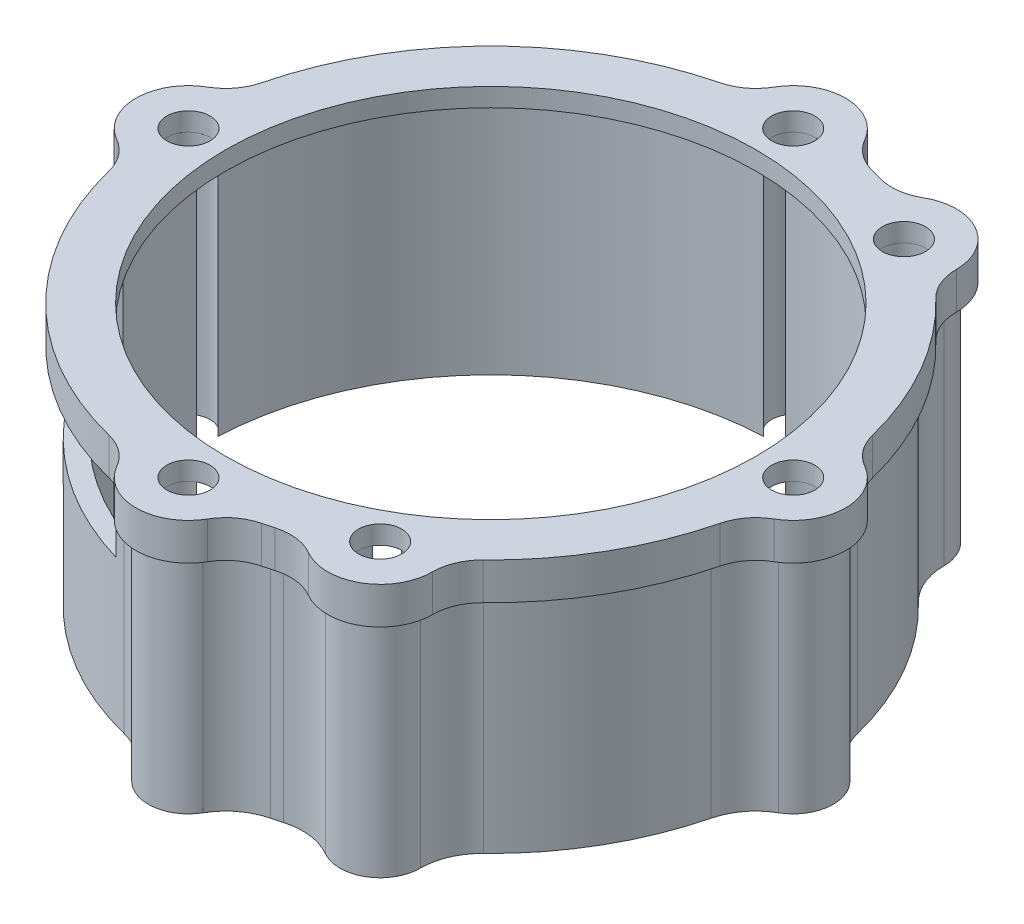
from build123d import *

# Parameters (mm, degrees)
SKETCH1_R               = 49
SKETCH1_R_2             = 46
BOSS_EXTRUDE1_DEPTH     = 39.6
SKETCH4_R               = 49
SKETCH4_R_2             = 43
BOSS_EXTRUDE3_DEPTH     = 3
CUT_EXTRUDE5_DEPTH      = 80.813282103
CUT_EXTRUDE5_DEPTH_BACK = 80.813282103
SKETCH2_R               = 3.5
BOSS_EXTRUDE5_START     = -42.6
BOSS_EXTRUDE5_DEPTH     = 42.6
FILLET1_R               = 10
BOSS_EXTRUDE7_START     = -6
BOSS_EXTRUDE7_DEPTH     = 6
CUT_EXTRUDE8_START      = -16
CUT_EXTRUDE8_DEPTH      = 16
FILLET2_R               = 1


with BuildPart() as part:
    # Sketch1 → Boss-Extrude1 (new body)
    with BuildSketch(Plane(origin=(0, 0, 0), x_dir=(1, 0, 0), z_dir=(0, 1, 0))):
        with Locations(Location((0, 0, 0), (0, 0, 90))):
            Circle(SKETCH1_R)
        with Locations(Location((0, 0, 0), (0, 0, 90))):
            Circle(SKETCH1_R_2, mode=Mode.SUBTRACT)
    extrude(amount=BOSS_EXTRUDE1_DEPTH)

    # Sketch4 → Boss-Extrude3 (add)
    with BuildSketch(Plane(origin=(0, 39.6, 0), x_dir=(1, 0, 0), z_dir=(0, 1, 0))):
        with Locations(Location((0, 0, 0), (0, 0, 90))):
            Circle(SKETCH4_R)
        with Locations(Location((0, 0, 0), (0, 0, 270))):
            Circle(SKETCH4_R_2, mode=Mode.SUBTRACT)
    extrude(amount=BOSS_EXTRUDE3_DEPTH)

    # Sketch2 → Cut-Extrude5 (cut, two sides: drawn at the far end of the back side and taken through both)
    with BuildSketch(Plane(origin=(0, 39.6, 0), x_dir=(1, 0, 0), z_dir=(0, 1, 0)).offset(-CUT_EXTRUDE5_DEPTH_BACK)):
        with Locations((24.5, 42.435244785)):
            Circle(SKETCH2_R)
        with Locations((0, 49)):
            Circle(SKETCH2_R)
        with Locations((24.5, -42.435244785)):
            Circle(SKETCH2_R)
        with Locations((0, -49)):
            Circle(SKETCH2_R)
        with Locations((49, 0)):
            Circle(SKETCH2_R)
        with Locations((-49, 0)):
            Circle(SKETCH2_R)
    extrude(amount=CUT_EXTRUDE5_DEPTH + CUT_EXTRUDE5_DEPTH_BACK, mode=Mode.SUBTRACT)

    # Boss-Extrude5: read off the stored shape, not the designer's step
    # Boss-Extrude5 outline → Boss-Extrude5 (add)
    with BuildSketch(Plane(origin=(0, 42.6, 0), x_dir=(1, 0, 0), z_dir=(0, 1, 0)).offset(BOSS_EXTRUDE5_START)):
        with BuildLine():
            ThreePointArc((21.408344796, 44.075875182), (26.25, 45.466333698), (27.466655204, 40.578108038))
            ThreePointArc((27.466655204, 40.578108038), (28.697413171, 39.717231491), (29.901208316, 38.819038386))
            ThreePointArc((29.901208316, 38.819038386), (27.75, 48.06440991), (18.667669235, 45.304725199))
            ThreePointArc((18.667669235, 45.304725199), (20.047424853, 44.711304574), (21.408344796, 44.075875182))
        make_face()
        with BuildLine():
            ThreePointArc((3.497767145, 48.875), (4.994073084, 48.744838024), (6.485686813, 48.568877551))
            ThreePointArc((6.485686813, 48.568877551), (0, 55.5), (-6.485686813, 48.568877551))
            ThreePointArc((-6.485686813, 48.568877551), (-4.994073084, 48.744838024), (-3.497767145, 48.875))
            ThreePointArc((-3.497767145, 48.875), (0, 52.5), (3.497767145, 48.875))
        make_face()
        with BuildLine():
            ThreePointArc((48.568877551, -6.485686813), (55.5, 0), (48.568877551, 6.485686813))
            ThreePointArc((48.568877551, 6.485686813), (48.744838024, 4.994073084), (48.875, 3.497767145))
            ThreePointArc((48.875, 3.497767145), (52.5, 0), (48.875, -3.497767145))
            ThreePointArc((48.875, -3.497767145), (48.744838024, -4.994073084), (48.568877551, -6.485686813))
        make_face()
        with BuildLine():
            ThreePointArc((-48.875, 3.497767145), (-48.744838024, 4.994073084), (-48.568877551, 6.485686813))
            ThreePointArc((-48.568877551, 6.485686813), (-55.5, 0), (-48.568877551, -6.485686813))
            ThreePointArc((-48.568877551, -6.485686813), (-48.744838024, -4.994073084), (-48.875, -3.497767145))
            ThreePointArc((-48.875, -3.497767145), (-52.5, 0), (-48.875, 3.497767145))
        make_face()
        with BuildLine():
            ThreePointArc((18.667669235, -45.304725199), (27.75, -48.06440991), (29.901208316, -38.819038386))
            ThreePointArc((29.901208316, -38.819038386), (28.697413171, -39.717231491), (27.466655204, -40.578108038))
            ThreePointArc((27.466655204, -40.578108038), (26.25, -45.466333698), (21.408344796, -44.075875182))
            ThreePointArc((21.408344796, -44.075875182), (20.047424853, -44.711304574), (18.667669235, -45.304725199))
        make_face()
        with BuildLine():
            ThreePointArc((-3.497767145, -48.875), (-4.994073084, -48.744838024), (-6.485686813, -48.568877551))
            ThreePointArc((-6.485686813, -48.568877551), (0, -55.5), (6.485686813, -48.568877551))
            ThreePointArc((6.485686813, -48.568877551), (4.994073084, -48.744838024), (3.497767145, -48.875))
            ThreePointArc((3.497767145, -48.875), (0, -52.5), (-3.497767145, -48.875))
        make_face()
    extrude(amount=BOSS_EXTRUDE5_DEPTH)

    # Fillet1
    fillet1_edges = [part.edges().sort_by_distance(p)[0] for p in [
        (48.568877551, 21.3, -6.485686813),
        (48.568877551, 21.3, 6.485686813),
        (-6.485686813, 21.3, -48.568877551),
        (6.485686813, 21.3, -48.568877551),
        (-48.568877551, 21.3, 6.485686813),
        (-48.568877551, 21.3, -6.485686813),
        (6.485686813, 21.3, 48.568877551),
        (-6.485686813, 21.3, 48.568877551),
        (18.667669235, 21.3, -45.304725199),
        (29.901208316, 21.3, -38.819038386),
        (29.901208316, 21.3, 38.819038386),
        (18.667669235, 21.3, 45.304725199),
    ]]
    fillet(fillet1_edges, radius=FILLET1_R)


with BuildPart() as body_2:
    # Split1: read off the stored shape, not the designer's step
    # Split1: the piece on the far side of the plane
    add(part.part)
    split(bisect_by=Plane(origin=(0, 39.6, 0), x_dir=(1, 0, 0), z_dir=(0, 1, 0)), keep=Keep.BOTTOM)

    # Cut-Extrude8: read off the stored shape, not the designer's step
    # Cut-Extrude8 outline → Cut-Extrude8 (cut)
    with BuildSketch(Plane(origin=(0, 39.6, 0), x_dir=(1, 0, 0), z_dir=(0, 1, 0)).offset(CUT_EXTRUDE8_START)):
        with BuildLine():
            Line((-13.674418605, -47.053270617), (-12.837209302, -44.172458131))
            ThreePointArc((-12.837209302, -44.172458131), (-31.034115291, -33.954140957), (-42.843194334, -16.746960897))
            Line((-42.843194334, -16.746960897), (-45.637315703, -17.839153999))
            ThreePointArc((-45.637315703, -17.839153999), (-33.058079332, -36.168541454), (-13.674418605, -47.053270617))
        make_face()
    extrude(amount=CUT_EXTRUDE8_DEPTH, mode=Mode.SUBTRACT)

    # Fillet2
    fillet2_edges = [body_2.edges().sort_by_distance(p)[0] for p in [
        (31.793206166, 39.6, -38.523206516),
        (17.465472395, 39.6, -46.795327465),
        (-8.27212095, 39.6, -49.258678561),
        (8.27212095, 39.6, -49.258678561),
        (-49.258678561, 39.6, -8.27212095),
        (-49.258678561, 39.6, 8.27212095),
        (-8.27212095, 39.6, 49.258678561),
        (8.27212095, 39.6, 49.258678561),
        (17.465472395, 39.6, 46.795327465),
        (31.793206166, 39.6, 38.523206516),
        (49.258678561, 39.6, 8.27212095),
        (49.258678561, 39.6, -8.27212095),
        (42.435244785, 39.6, -24.5),
        (42.435244785, 39.6, 24.5),
        (-12.775105495, 39.6, 47.305355718),
        (12.68213321, 39.6, 47.330365488),
        (12.68213321, 39.6, -47.330365488),
        (-34.648232278, 39.6, -34.648232278),
        (-55.5, 39.6, 0),
        (0, 39.6, -55.5),
        (27.75, 39.6, 48.06440991),
        (0, 39.6, 55.5),
        (55.5, 39.6, 0),
        (27.75, 39.6, -48.06440991),
        (-46.684249483, 39.6, 14.885592033),
    ]]
    fillet(fillet2_edges, radius=FILLET2_R)


with BuildPart() as part_1:
    add(part.part)

    # Split1
    split(bisect_by=Plane(origin=(0, 39.6, 0), x_dir=(1, 0, 0), z_dir=(0, 1, 0)), keep=Keep.TOP)

    # Sketch10 → Boss-Extrude7 (add)
    with BuildSketch(Plane(origin=(0, 42.6, 0), x_dir=(1, 0, 0), z_dir=(0, 1, 0)).offset(BOSS_EXTRUDE7_START)):
        with BuildLine():
            ThreePointArc((-53.246057514, 7.36349072), (-50.855412237, 9.476463745), (-49.480672778, 12.355687819))
            ThreePointArc((-49.480672778, 12.355687819), (-36.062445841, 36.062445841), (-12.355687819, 49.480672778))
            ThreePointArc((-12.355687819, 49.480672778), (-9.476463745, 50.855412237), (-7.36349072, 53.246057514))
            ThreePointArc((-7.36349072, 53.246057514), (0, 57.5), (7.36349072, 53.246057514))
            ThreePointArc((7.36349072, 53.246057514), (9.476463745, 50.855412237), (12.355687819, 49.480672778))
            ThreePointArc((12.355687819, 49.480672778), (13.1997713, 49.262217141), (14.039996856, 49.029363531))
            ThreePointArc((14.039996856, 49.029363531), (17.220847777, 48.780310789), (20.246058733, 49.794183819))
            ThreePointArc((20.246058733, 49.794183819), (28.75, 49.796460718), (32.999998781, 42.430693098))
            ThreePointArc((32.999998781, 42.430693098), (33.63456446, 39.303847044), (35.440675921, 36.673675712))
            ThreePointArc((35.440675921, 36.673675712), (44.167295593, 25.5), (49.480672778, 12.355687819))
            ThreePointArc((49.480672778, 12.355687819), (50.855412237, 9.476463745), (53.246057514, 7.36349072))
            ThreePointArc((53.246057514, 7.36349072), (57.5, 0), (53.246057514, -7.36349072))
            ThreePointArc((53.246057514, -7.36349072), (50.855412237, -9.476463745), (49.480672778, -12.355687819))
            ThreePointArc((49.480672778, -12.355687819), (44.167295593, -25.5), (35.440675921, -36.673675712))
            ThreePointArc((35.440675921, -36.673675712), (33.63456446, -39.303847044), (32.999998781, -42.430693098))
            ThreePointArc((32.999998781, -42.430693098), (28.75, -49.796460718), (20.246058733, -49.794183819))
            ThreePointArc((20.246058733, -49.794183819), (17.220847777, -48.780310789), (14.039996856, -49.029363531))
            ThreePointArc((14.039996856, -49.029363531), (13.1997713, -49.262217141), (12.355687819, -49.480672778))
            ThreePointArc((12.355687819, -49.480672778), (9.476463745, -50.855412237), (7.36349072, -53.246057514))
            ThreePointArc((7.36349072, -53.246057514), (0, -57.5), (-7.36349072, -53.246057514))
            ThreePointArc((-7.36349072, -53.246057514), (-9.476463745, -50.855412237), (-12.355687819, -49.480672778))
            ThreePointArc((-12.355687819, -49.480672778), (-36.062445841, -36.062445841), (-49.480672778, -12.355687819))
            ThreePointArc((-49.480672778, -12.355687819), (-50.855412237, -9.476463745), (-53.246057514, -7.36349072))
            ThreePointArc((-53.246057514, -7.36349072), (-57.5, 0), (-53.246057514, 7.36349072))
        make_face()
        with BuildLine():
            ThreePointArc((-52.246985158, 5.630904668), (-49.258678561, 8.27212095), (-47.540254237, 11.871151042))
            ThreePointArc((-47.540254237, 11.871151042), (-34.648232278, 34.648232278), (-11.871151042, 47.540254237))
            ThreePointArc((-11.871151042, 47.540254237), (-8.27212095, 49.258678561), (-5.630904668, 52.246985158))
            ThreePointArc((-5.630904668, 52.246985158), (0, 55.5), (5.630904668, 52.246985158))
            ThreePointArc((5.630904668, 52.246985158), (8.27212095, 49.258678561), (11.871151042, 47.540254237))
            ThreePointArc((11.871151042, 47.540254237), (12.68213321, 47.330365488), (13.489408744, 47.106643393))
            ThreePointArc((13.489408744, 47.106643393), (17.465472395, 46.795327466), (21.24698609, 48.062668752))
            ThreePointArc((21.24698609, 48.062668752), (27.75, 48.06440991), (30.999999068, 42.431764083))
            ThreePointArc((30.999999068, 42.431764083), (31.793206166, 38.523206516), (34.050845493, 35.235492351))
            ThreePointArc((34.050845493, 35.235492351), (42.435244785, 24.5), (47.540254237, 11.871151042))
            ThreePointArc((47.540254237, 11.871151042), (49.258678561, 8.27212095), (52.246985158, 5.630904668))
            ThreePointArc((52.246985158, 5.630904668), (55.5, 0), (52.246985158, -5.630904668))
            ThreePointArc((52.246985158, -5.630904668), (49.258678561, -8.27212095), (47.540254237, -11.871151042))
            ThreePointArc((47.540254237, -11.871151042), (42.435244785, -24.5), (34.050845493, -35.235492351))
            ThreePointArc((34.050845493, -35.235492351), (31.793206166, -38.523206516), (30.999999068, -42.431764083))
            ThreePointArc((30.999999068, -42.431764083), (27.75, -48.06440991), (21.24698609, -48.062668752))
            ThreePointArc((21.24698609, -48.062668752), (17.465472395, -46.795327466), (13.489408744, -47.106643393))
            ThreePointArc((13.489408744, -47.106643393), (12.68213321, -47.330365488), (11.871151042, -47.540254237))
            ThreePointArc((11.871151042, -47.540254237), (8.27212095, -49.258678561), (5.630904668, -52.246985158))
            ThreePointArc((5.630904668, -52.246985158), (0, -55.5), (-5.630904668, -52.246985158))
            ThreePointArc((-5.630904668, -52.246985158), (-8.27212095, -49.258678561), (-11.871151042, -47.540254237))
            ThreePointArc((-11.871151042, -47.540254237), (-34.648232278, -34.648232278), (-47.540254237, -11.871151042))
            ThreePointArc((-47.540254237, -11.871151042), (-49.258678561, -8.27212095), (-52.246985158, -5.630904668))
            ThreePointArc((-52.246985158, -5.630904668), (-55.5, 0), (-52.246985158, 5.630904668))
        make_face(mode=Mode.SUBTRACT)
    extrude(amount=BOSS_EXTRUDE7_DEPTH)


solid = Compound([body_2.part, part_1.part])
